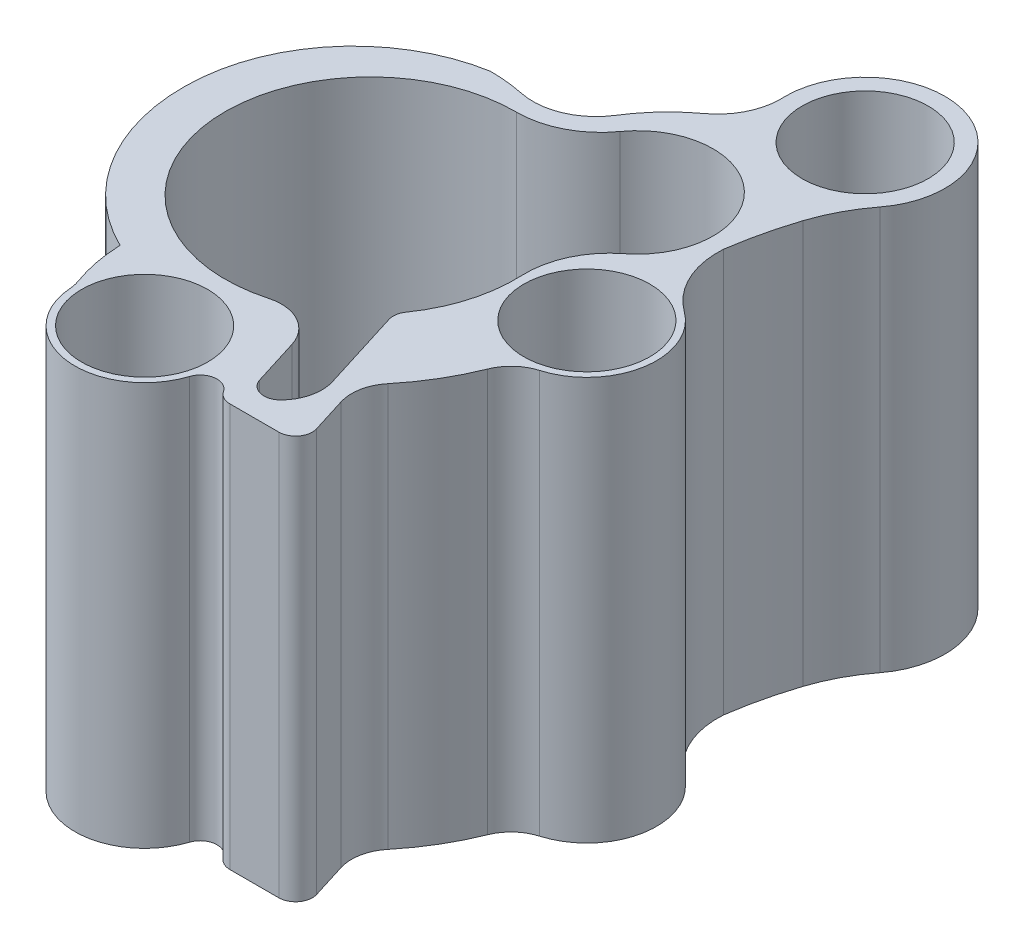
from build123d import *

# Parameters (mm, degrees)
SKETCH1_R               = 4.7625
BOSS_EXTRUDE2_DEPTH     = 30.48
FILLET1_R               = 3.175
FILLET3_R               = 1.27
FILLET4_R               = 3.175
FILLET5_R               = 1.27
FILLET6_R               = 1.27
BOSS_EXTRUDE9_START     = -30.48
BOSS_EXTRUDE9_DEPTH     = 30.48
CUT_EXTRUDE6_START      = -30.48
CUT_EXTRUDE6_DEPTH      = 30.48
FILLET9_R               = 6.35
CUT_EXTRUDE7_DEPTH      = 44.536935081
CUT_EXTRUDE7_DEPTH_BACK = 44.536935081
BOSS_EXTRUDE11_START    = -30.48
SKETCH4_R               = 4.7625
BOSS_EXTRUDE11_DEPTH    = 30.48
FILLET10_R              = 12.7
FILLET11_R              = 12.7


with BuildPart() as part:
    # Sketch1 → Boss-Extrude2 (new body)
    with BuildSketch(Plane(origin=(0, 0, 0), x_dir=(1, 0, 0), z_dir=(0, 1, 0))):
        with BuildLine():
            Line((11.860213807, -12.884548704), (13.754545104, -18.945407466))
            Line((13.754545104, -18.945407466), (7.404545104, -18.945407466))
            Line((7.404545104, -18.945407466), (6.640447212, -16.500698134))
            ThreePointArc((6.640447212, -16.500698134), (5.961240353, -16.792309403), (5.2705, -17.055438375))
            ThreePointArc((5.2705, -17.055438375), (0, -22.325938375), (-5.2705, -17.055438375))
            ThreePointArc((-5.2705, -17.055438375), (-5.919586773, -14.929400926), (-6.188032569, -12.722755117))
            ThreePointArc((-6.188032569, -12.722755117), (-14.1478, 0), (-6.188032569, 12.722755117))
            ThreePointArc((-6.188032569, 12.722755117), (-5.919586773, 14.929400926), (-5.2705, 17.055438375))
            ThreePointArc((-5.2705, 17.055438375), (0, 22.325938375), (5.2705, 17.055438375))
            ThreePointArc((5.2705, 17.055438375), (12.040379738, 12.314885712), (16.362502035, 5.2705))
            ThreePointArc((16.362502035, 5.2705), (21.633002035, 0), (16.362502035, -5.2705))
            ThreePointArc((16.362502035, -5.2705), (14.592418813, -9.361982053), (11.860213807, -12.884548704))
        make_face()
        with Locations(Location((0, 17.055438375, 0), (0, 0, 90))):
            Circle(SKETCH1_R, mode=Mode.SUBTRACT)
        with Locations(Location((16.362502035, 0, 0), (0, 0, 90))):
            Circle(SKETCH1_R, mode=Mode.SUBTRACT)
        with Locations(Location((0, -17.055438375, 0), (0, 0, 90))):
            Circle(SKETCH1_R, mode=Mode.SUBTRACT)
        with BuildLine():
            Line((5.737156066, -9.353468881), (8.338191551, -17.675407466))
            Line((8.338191551, -17.675407466), (12.027017511, -17.675407466))
            Line((12.027017511, -17.675407466), (8.623309815, -6.785342119))
            ThreePointArc((8.623309815, -6.785342119), (-7.294145861, 8.197424961), (5.737156066, -9.353468881))
        make_face(mode=Mode.SUBTRACT)
    extrude(amount=BOSS_EXTRUDE2_DEPTH)

    # Fillet1
    # the kernel refuses this fillet: 3.175 mm, written as the material it adds along each edge
    with BuildSketch(Plane(origin=(-6.188032569, 0, -12.722755117), x_dir=(-0.8747186698844794, 0, 0.4846310437389738), z_dir=(0, 1, 0))) as fillet1_piece_1:
        with BuildLine():
            CenterArc((1.675106808, -3.170499128), FILLET1_R, 93.05116293, 49.316383357)
            ThreePointArc((-0.839315123, -1.231863693), (-0.401568779, -0.628256415), (0, 0))
            ThreePointArc((0, 0), (0.753054473, -0.020055884), (1.506108946, 0))
        make_face()
    extrude(amount=30.48)
    with BuildSketch(Plane(origin=(-5.2705, 0, -17.055438375), x_dir=(-0.35770128840140486, 0, 0.9338360607065755), z_dir=(0, 1, 0))) as fillet1_piece_2:
        with BuildLine():
            CenterArc((0.51828136, -3.174477714), FILLET1_R, 91.039263795, 15.495369937)
            ThreePointArc((-0.385307362, -0.130770695), (-0.191391238, -0.069105054), (0, 0))
            ThreePointArc((0, 0), (0.230347271, -0.002089143), (0.460694542, 0))
        make_face()
    extrude(amount=30.48)
    with BuildSketch(Plane(origin=(5.2705, 0, -17.055438375), x_dir=(-0.12720688847868244, 0, -0.9918762057452392), z_dir=(0, 1, 0))) as fillet1_piece_3:
        with BuildLine():
            CenterArc((1.744769682, -3.149206953), FILLET1_R, 97.308218729, 47.663807195)
            ThreePointArc((-0.855148612, -1.326832167), (-0.414685297, -0.671723102), (0, 0))
            ThreePointArc((0, 0), (0.670443906, -0.042816458), (1.340887811, 0))
        make_face()
    extrude(amount=30.48)
    with BuildSketch(Plane(origin=(16.362502035, 0, -5.2705), x_dir=(-0.3771647323765371, 0, -0.9261461896759794), z_dir=(0, 1, 0))) as fillet1_piece_4:
        with BuildLine():
            CenterArc((1.804499427, -3.172306197), FILLET1_R, 92.360366346, 49.97819677)
            ThreePointArc((-0.70894152, -1.232399084), (-0.312723775, -0.640214629), (0, 0))
            ThreePointArc((0, 0), (0.8368693, -0.017240341), (1.673738599, 0))
        make_face()
    extrude(amount=30.48)
    with BuildSketch(Plane(origin=(16.362502035, 0, 5.2705), x_dir=(0.9898341628287173, 0, -0.14222633404954374), z_dir=(0, 1, 0))) as fillet1_piece_5:
        with BuildLine():
            CenterArc((1.950776398, -3.142723467), FILLET1_R, 98.176695151, 51.81827723)
            ThreePointArc((-0.798714948, -1.554982197), (-0.380235314, -0.787313176), (0, 0))
            ThreePointArc((0, 0), (0.749603894, -0.053579045), (1.499207787, 0))
        make_face()
    extrude(amount=30.48)
    with BuildSketch(Plane(origin=(11.860213807, 0, 12.884548704), x_dir=(0.29831988928740816, 0, 0.9544659468286695), z_dir=(0, 1, 0))) as fillet1_piece_6:
        with BuildLine():
            CenterArc((1.816465361, 3.175), FILLET1_R, 213.037149694, 56.962850306)
            ThreePointArc((-0.845191928, 1.444044923), (-0.405599886, 0.731970177), (0, 0))
            Line((0, 0), (1.816465361, 0))
        make_face()
    extrude(amount=30.48)
    with BuildSketch(Plane(origin=(5.2705, 0, 17.055438375), x_dir=(0.9268908474954334, 0, -0.37533099636080863), z_dir=(0, 1, 0))) as fillet1_piece_7:
        with BuildLine():
            CenterArc((1.820147869, -3.156511003), FILLET1_R, 96.186334825, 46.370096176)
            ThreePointArc((-0.700651409, -1.226175281), (-0.30907029, -0.636661485), (0, 0))
            ThreePointArc((0, 0), (0.73900137, -0.015364429), (1.47800274, 0))
        make_face()
    extrude(amount=30.48)
    with BuildSketch(Plane(origin=(-5.2705, 0, 17.055438375), x_dir=(0.038601082712793416, 0, 0.999254700471006), z_dir=(0, 1, 0))) as fillet1_piece_8:
        with BuildLine():
            CenterArc((0.52945245, -3.172633674), FILLET1_R, 92.212228742, 15.495369937)
            ThreePointArc((-0.436253651, -0.148061518), (-0.217455401, -0.076009068), (0, 0))
            ThreePointArc((0, 0), (0.203447006, -0.003928101), (0.406894013, 0))
        make_face()
    extrude(amount=30.48)
    # the kernel refuses this fillet: 3.175 mm, written as the material it takes off along each edge
    with BuildSketch(Plane(origin=(5.737156066, -8.75064331, 9.353468881), x_dir=(0.29831988928740744, 0, 0.9544659468286697), z_dir=(0, 1, 0))) as fillet1_2_piece_1:
        with BuildLine():
            CenterArc((3.500257324, -3.175), FILLET1_R, 90, 88.017608619)
            ThreePointArc((0.327157544, -3.065169276), (0.271751922, -1.521038893), (0, 0))
            Line((0, 0), (3.500257324, 0))
        make_face()
    extrude(amount=47.98128662, mode=Mode.SUBTRACT)

    # Fillet3
    fillet3_edges = [part.edges().sort_by_distance(p)[0] for p in [
        (13.754545104, 15.24, 18.945407466),
        (7.404545104, 15.24, 18.945407466),
    ]]
    fillet(fillet3_edges, radius=FILLET3_R)

    # Fillet4
    # the kernel refuses this fillet: 3.175 mm, written as the material it adds along each edge
    with BuildSketch(Plane(origin=(12.027017511, 0, 17.675407466), x_dir=(-0.29831988928740777, 0, -0.9544659468286695), z_dir=(0, 1, 0))) as fillet4_piece_1:
        with BuildLine():
            CenterArc((4.256556411, 3.175), FILLET4_R, 173.746252409, 96.253747591)
            Line((1.100450152, 3.520858762), (1.037328027, 3.527775938))
            ThreePointArc((1.037328027, 3.527775938), (0.489616488, 1.779372694), (-0.060608588, 0.018943313))
            Line((-0.060608588, 0.018943313), (0, -0.0635))
            Line((0, -0.0635), (4.256556411, -0.0635))
            Line((4.256556411, -0.0635), (4.256556411, 0))
        make_face()
    extrude(amount=30.48)

    # Fillet5
    fillet5_edges = [part.edges().sort_by_distance(p)[0] for p in [
        (8.338191551, 15.24, 17.675407466),
    ]]
    fillet(fillet5_edges, radius=FILLET5_R)

    # Fillet6
    fillet6_edges = [part.edges().sort_by_distance(p)[0] for p in [
        (6.640447212, 15.24, 16.500698134),
        (8.623309815, 15.24, 6.785342119),
    ]]
    fillet(fillet6_edges, radius=FILLET6_R)

    # Sketch2 → Boss-Extrude9 (add)
    with BuildSketch(Plane(origin=(0, 30.48, 0), x_dir=(1, 0, 0), z_dir=(0, 1, 0)).offset(BOSS_EXTRUDE9_START)):
        with BuildLine():
            ThreePointArc((7.943426233, 15.662766674), (13.175324303, 14.973004025), (15.611766116, 10.291948459))
            ThreePointArc((15.611766116, 10.291948459), (15.492196473, 9.129027942), (15.138490831, 8.014768839))
            ThreePointArc((15.138490831, 8.014768839), (15.444654673, 7.422560084), (15.731226864, 6.820626626))
            ThreePointArc((15.731226864, 6.820626626), (15.781158654, 6.716236617), (15.834861283, 6.61373547))
            ThreePointArc((15.834861283, 6.61373547), (16.614943687, 8.379799111), (16.881766116, 10.291948459))
            ThreePointArc((16.881766116, 10.291948459), (13.476256049, 16.290071233), (6.580412696, 16.439470316))
            ThreePointArc((6.580412696, 16.439470316), (6.637545403, 16.407150651), (6.69533405, 16.376019005))
            ThreePointArc((6.69533405, 16.376019005), (7.325689413, 16.030433186), (7.943426233, 15.662766674))
        make_face()
    extrude(amount=BOSS_EXTRUDE9_DEPTH)

    # Sketch2<12> → Cut-Extrude6 (cut)
    with BuildSketch(Plane(origin=(0, 30.48, 0), x_dir=(1, 0, 0), z_dir=(0, 1, 0)).offset(CUT_EXTRUDE6_START)):
        with BuildLine():
            ThreePointArc((15.138490831, 8.014768839), (12.043511127, 12.311557951), (7.943426233, 15.662766674))
            ThreePointArc((7.943426233, 15.662766674), (5.173639716, 13.509603196), (4.183683511, 10.143920944))
            ThreePointArc((4.183683511, 10.143920944), (7.605607592, 7.90930294), (9.972426866, 4.577449316))
            ThreePointArc((9.972426866, 4.577449316), (13.062589614, 5.533925069), (15.138490831, 8.014768839))
        make_face()
    extrude(amount=CUT_EXTRUDE6_DEPTH, mode=Mode.SUBTRACT)

    # Fillet9
    fillet9_edges = [part.edges().sort_by_distance(p)[0] for p in [
        (6.580412696, 15.24, -16.439470316),
        (15.834861283, 15.24, -6.61373547),
        (9.972426866, 15.24, -4.577449316),
        (4.183683511, 15.24, -10.143920944),
    ]]
    fillet(fillet9_edges, radius=FILLET9_R)

    # Sketch3 → Cut-Extrude7 (cut, two sides: drawn at the far end of the back side and taken through both)
    with BuildSketch(Plane(origin=(0, 30.48, 0), x_dir=(1, 0, 0), z_dir=(0, 1, 0)).offset(-CUT_EXTRUDE7_DEPTH_BACK)):
        with BuildLine():
            Line((-7.505454184, 11.992847966), (-2.296148987, 12.883016287))
            ThreePointArc((-2.296148987, 12.883016287), (2.423426985, 12.955632538), (4.7625, 17.055438375))
            Line((4.7625, 17.055438375), (9.734184624, 17.275056095))
            ThreePointArc((9.734184624, 17.275056095), (-1.208436668, 22.214922829), (-7.505454184, 11.992847966))
        make_face()
    extrude(amount=CUT_EXTRUDE7_DEPTH + CUT_EXTRUDE7_DEPTH_BACK, mode=Mode.SUBTRACT)

    # Sketch4 → Boss-Extrude11 (add)
    with BuildSketch(Plane(origin=(0, 30.48, 0), x_dir=(1, 0, 0), z_dir=(0, 1, 0)).offset(BOSS_EXTRUDE11_START)):
        with BuildLine():
            ThreePointArc((16.86594215, 9.822043775), (17.712963238, 13.767422556), (19.105519309, 17.554802394))
            ThreePointArc((19.105519309, 17.554802394), (17.767180424, 27.639662161), (9.18901652, 22.17059903))
            ThreePointArc((9.18901652, 22.17059903), (9.198998035, 21.978650402), (9.201259866, 21.786455734))
            ThreePointArc((9.201259866, 21.786455734), (7.906472539, 18.553470941), (4.7625, 17.055438375))
            Line((4.7625, 17.055438375), (9.734184624, 17.275056095))
            ThreePointArc((9.734184624, 17.275056095), (14.943475982, 15.121124841), (16.86594215, 9.822043775))
        make_face()
        with Locations(Location((15.22151652, 22.17059903, 0), (0, 0, 270))):
            Circle(SKETCH4_R, mode=Mode.SUBTRACT)
    extrude(amount=BOSS_EXTRUDE11_DEPTH)

    # Fillet10
    fillet10_edges = [part.edges().sort_by_distance(p)[0] for p in [
        (4.7625, 15.24, -17.055438375),
        (19.105519309, 15.24, -17.554802394),
        (-7.505454184, 15.24, -11.992847966),
    ]]
    fillet(fillet10_edges, radius=FILLET10_R)

    # Fillet11
    # the kernel refuses this fillet: 12.7 mm, written as the material it takes off along each edge
    with BuildSketch(Plane(origin=(-2.296148987, -3.519120011, -12.883016287), x_dir=(0.9377307104980771, 0, 0.3473630875449655), z_dir=(0, 1, 0))) as fillet11_piece_1:
        with BuildLine():
            CenterArc((3.28451201, -12.560548615), FILLET11_R, 98.498560753, 11.829576247)
            Line((-1.127419619, -0.651524335), (-1.215658252, -0.413343849))
            ThreePointArc((-1.215658252, -0.413343849), (-0.690798794, -0.105843114), (-0.127088985, 0.219919053))
            Line((-0.127088985, 0.219919053), (0.03753728, 0.251210972))
            ThreePointArc((0.03753728, 0.251210972), (0.703824002, 0.201705731), (1.370110724, 0.251210972))
            Line((1.370110724, 0.251210972), (1.407648004, 0))
        make_face()
    extrude(amount=37.518240022, mode=Mode.SUBTRACT)


solid = part.part
